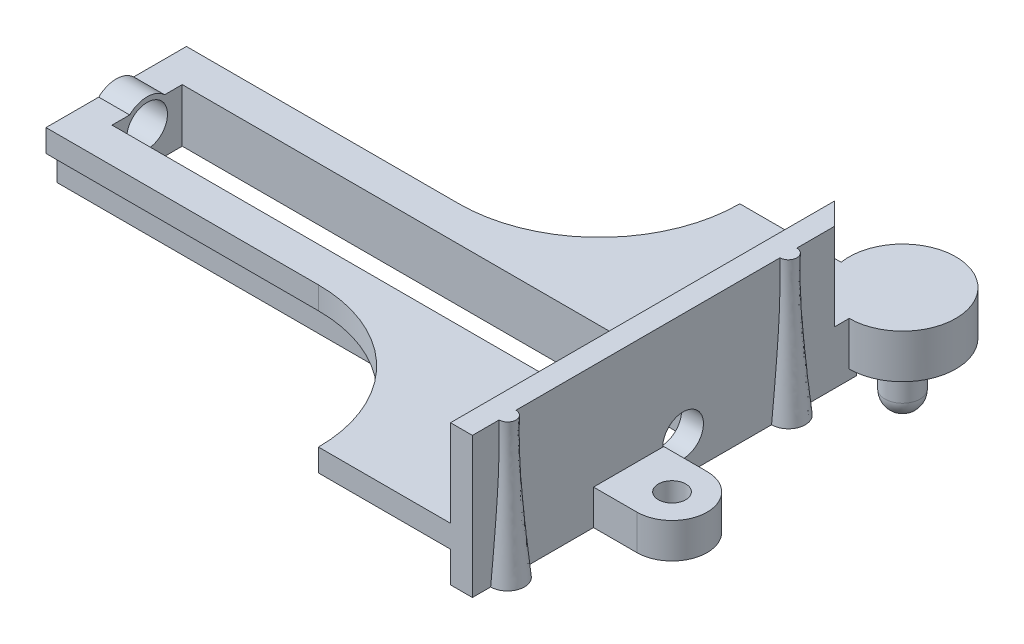
from build123d import *

# Parameters (mm, degrees)
BOSS_EXTRUDE1_DEPTH     = 98.552
CUT_EXTRUDE2_DEPTH      = 100.834602258
CUT_EXTRUDE2_DEPTH_BACK = 100.834602258
SKETCH2_W               = 92.964
SKETCH2_H               = 3.187725502
BOSS_EXTRUDE2_START     = -4.064
BOSS_EXTRUDE2_DEPTH     = 4.064
BOSS_EXTRUDE3_DEPTH     = 25.4
CUT_EXTRUDE3_DEPTH      = 109.948520702
CUT_EXTRUDE3_DEPTH_BACK = 109.948520702
SKETCH9_R               = 3.683
SKETCH11_R              = 2.47904
BOSS_EXTRUDE4_DEPTH     = 6.35
FILLET1_R               = 3.175
CUT_EXTRUDE4_DEPTH      = 15.748


with BuildPart() as part:
    # Sketch1 → Boss-Extrude1 (new body)
    with BuildSketch(Plane(origin=(0, 0, 0), x_dir=(0, 0, -1), z_dir=(1, 0, 0))):
        with BuildLine():
            Line((-10.668, -4.826), (10.668, -4.826))
            Line((10.668, -4.826), (10.668, 0.762))
            Line((10.668, 0.762), (12.7, 0.762))
            Line((12.7, 0.762), (12.7, 4.826))
            Line((12.7, 4.826), (3.162274498, 4.826))
            ThreePointArc((3.162274498, 4.826), (0, 6.096), (-3.162274498, 4.826))
            Line((-3.162274498, 4.826), (-12.7, 4.826))
            Line((-12.7, 4.826), (-12.7, 0.762))
            Line((-12.7, 0.762), (-10.668, 0.762))
            Line((-10.668, 0.762), (-10.668, -4.826))
        make_face()
    extrude(amount=BOSS_EXTRUDE1_DEPTH)

    # Sketch2 → Cut-Extrude2 (cut, two sides: drawn at the far end of the back side and taken through both)
    with BuildSketch(Plane(origin=(0, 4.826, 0), x_dir=(1, 0, 0), z_dir=(0, 1, 0)).offset(-CUT_EXTRUDE2_DEPTH_BACK)):
        with Locations((52.07, -4.756137249)):
            Rectangle(SKETCH2_W, SKETCH2_H)
        Polygon((5.588, 6.35), (5.588, 0), (5.588, -3.162274498), (98.552, -3.162274498), (98.552, 6.35), align=None)
    extrude(amount=CUT_EXTRUDE2_DEPTH + CUT_EXTRUDE2_DEPTH_BACK, mode=Mode.SUBTRACT)

    # Sketch3 → Boss-Extrude2 (add)
    with BuildSketch(Plane(origin=(0, 4.826, 0), x_dir=(1, 0, 0), z_dir=(0, 1, 0)).offset(BOSS_EXTRUDE2_START)):
        with BuildLine():
            Line((98.552, -12.7), (49.276, -12.7))
            ThreePointArc((49.276, -12.7), (67.236512242, -20.139487758), (74.676, -38.1))
            Line((74.676, -38.1), (98.552, -38.1))
            Line((98.552, -38.1), (98.552, -12.7))
        make_face()
    boss_extrude2 = extrude(amount=BOSS_EXTRUDE2_DEPTH)

    # Mirror1: Boss-Extrude2 across plane
    add(boss_extrude2.mirror(Plane.XY))

    # Sketch5 → Boss-Extrude3 (add)
    with BuildSketch(Plane.XZ.offset(4.826)):
        Polygon((98.552, 6.35), (98.552, 0), (98.552, -6.35), (98.552, -10.668), (98.552, -31.369), (102.5144, -31.369), (102.5144, 31.75), (102.5144, 38.1), (98.552, 38.1), (98.552, 10.668), align=None)
    extrude(amount=-BOSS_EXTRUDE3_DEPTH)

    # Loft1: read off the stored shape, not the designer's step
    # Loft1: loft between two sections, ruled curve by curve
    loft1_from = [
        Edge.make_bspline([(99.920568819, -4.826, 30.149267728), (96.719104275, -4.826, 35.336930089), (101.906766636, -4.826, 38.538394633), (105.108231181, -4.826, 33.350732272), (108.309695725, -4.826, 28.163069911), (103.122033364, -4.826, 24.961605367), (99.920568819, -4.826, 30.149267728)], [0.5, 0.5, 0.5, 0.5, 1, 1, 1, 1.5, 1.5, 1.5, 1.5], 3, [1, 0.333333333, 0.333333333, 1, 0.333333333, 0.333333333, 1]),
    ]
    loft1_to = [
        Edge.make_bspline([(101.34872832, 20.574, 32.731725793), (103.312179906, 20.574, 35.063069154), (105.643523267, 20.574, 33.099617568), (103.68007168, 20.574, 30.768274207), (101.716620094, 20.574, 28.436930846), (99.385276733, 20.574, 30.400382432), (101.34872832, 20.574, 32.731725793)], [0.5, 0.5, 0.5, 0.5, 1, 1, 1, 1.5, 1.5, 1.5, 1.5], 3, [1, 0.333333333, 0.333333333, 1, 0.333333333, 0.333333333, 1]),
    ]
    loft1 = Solid(Shell([*[Face.make_surface_from_curves(loft1_from[k], loft1_to[k]) for k in range(1)], Face(Wire(loft1_from)), Face(Wire(loft1_to))]))
    add(loft1)

    # Mirror2: Loft1 across plane
    add(loft1.mirror(Plane(origin=(0, 0, 6.35), x_dir=(1, 0, 0), z_dir=(0, 0, -1))))

    # Sketch9 → Cut-Extrude3 (cut, two sides: drawn at the far end of the back side and taken through both)
    with BuildSketch(Plane(origin=(5.588, 0, 0), x_dir=(0, 0, -1), z_dir=(1, 0, 0)).offset(-CUT_EXTRUDE3_DEPTH_BACK)):
        with Locations(Location((0, 1.524, 0), (0, 0, 180))):
            Circle(SKETCH9_R)
    extrude(amount=CUT_EXTRUDE3_DEPTH + CUT_EXTRUDE3_DEPTH_BACK, mode=Mode.SUBTRACT)

    # Sketch11 → Boss-Extrude4 (add)
    with BuildSketch(Plane.XZ.offset(4.826)):
        with BuildLine():
            Line((102.5144, 16.19504), (110.363, 16.19504))
            ThreePointArc((110.363, 16.19504), (116.713, 9.84504), (110.363, 3.49504))
            Line((110.363, 3.49504), (102.5144, 3.49504))
            Line((102.5144, 3.49504), (102.5144, 9.84504))
            Line((102.5144, 9.84504), (102.5144, 16.19504))
        make_face()
        with Locations(Location((110.363, 9.84504, 0), (0, 0, 270))):
            Circle(SKETCH11_R, mode=Mode.SUBTRACT)
    extrude(amount=-BOSS_EXTRUDE4_DEPTH)

    # Sketch14 → Revolve1 (revolve)
    with BuildSketch(Plane(origin=(0, 0, -39.68496), x_dir=(-1, 0, 0), z_dir=(0, 0, -1)), mode=Mode.PRIVATE) as revolve1_sk:
        Polygon((-102.5144, 4.826), (-102.5144, -14.224), (-105.6894, -14.224), (-105.6894, 1.4732), (-109.857134902, 1.4732), (-109.857134902, -3.0988), (-112.1664, -3.0988), (-112.1664, 4.826), align=None)
    revolve(revolve1_sk.sketch.rotate(Axis((102.5144, 4.826, -39.68496), (0, -1, 0)), 180), axis=Axis((102.5144, 4.826, -39.68496), (0, -1, 0)))

    # Fillet1
    fillet1_edges = [part.edges().sort_by_distance(p)[0] for p in [
        (105.6894, -14.224, -39.68496),
    ]]
    fillet(fillet1_edges, radius=FILLET1_R)

    # Sketch15 → Cut-Extrude4 (cut)
    with BuildSketch(Plane(origin=(0, 20.574, 0), x_dir=(1, 0, 0), z_dir=(0, 1, 0))):
        Polygon((98.552, 31.369), (102.5144, 27.4066), (102.5144, 31.369), align=None)
    extrude(amount=-CUT_EXTRUDE4_DEPTH, mode=Mode.SUBTRACT)


solid = part.part
